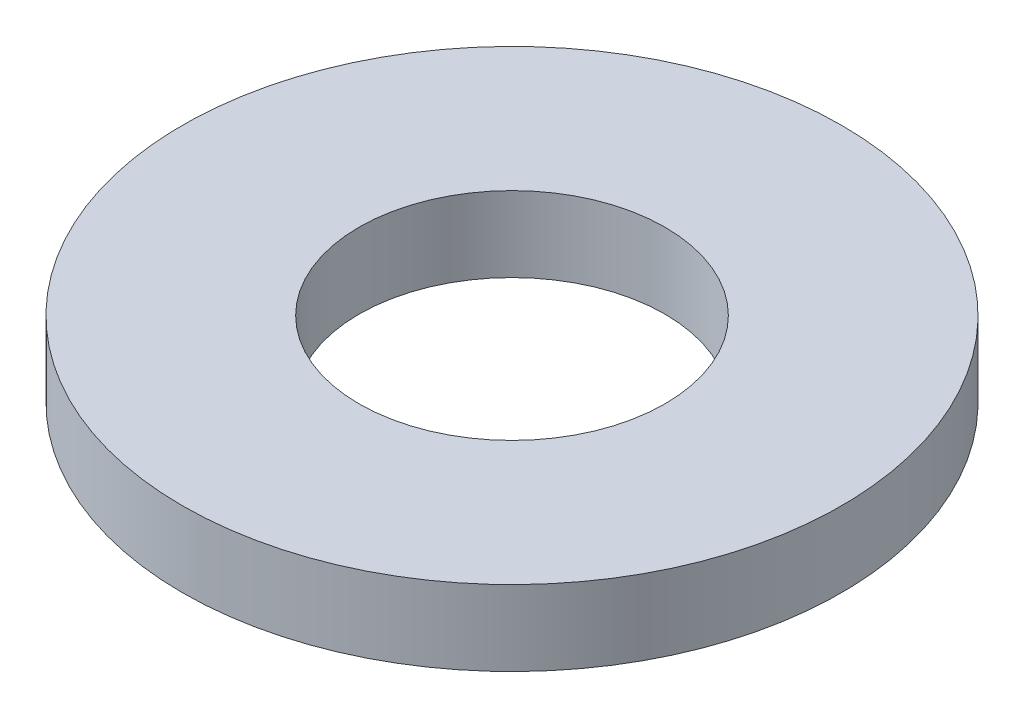
from build123d import *

# Parameters (mm, degrees)
SKETCH1_R           = 70
BOSS_EXTRUDE1_DEPTH = 16
SKETCH2_R           = 32.5
CUT_EXTRUDE1_DEPTH  = 101.279609094


with BuildPart() as part:
    # Sketch1 → Boss-Extrude1 (new body)
    with BuildSketch(Plane(origin=(0, 0, 0), x_dir=(1, 0, 0), z_dir=(0, 1, 0))):
        Circle(SKETCH1_R)
    extrude(amount=BOSS_EXTRUDE1_DEPTH)

    # Sketch2 → Cut-Extrude1 (cut, through all)
    with BuildSketch(Plane(origin=(0, 0, 0), x_dir=(1, 0, 0), z_dir=(0, 1, 0))):
        Circle(SKETCH2_R)
    extrude(amount=CUT_EXTRUDE1_DEPTH, mode=Mode.SUBTRACT)


solid = part.part
